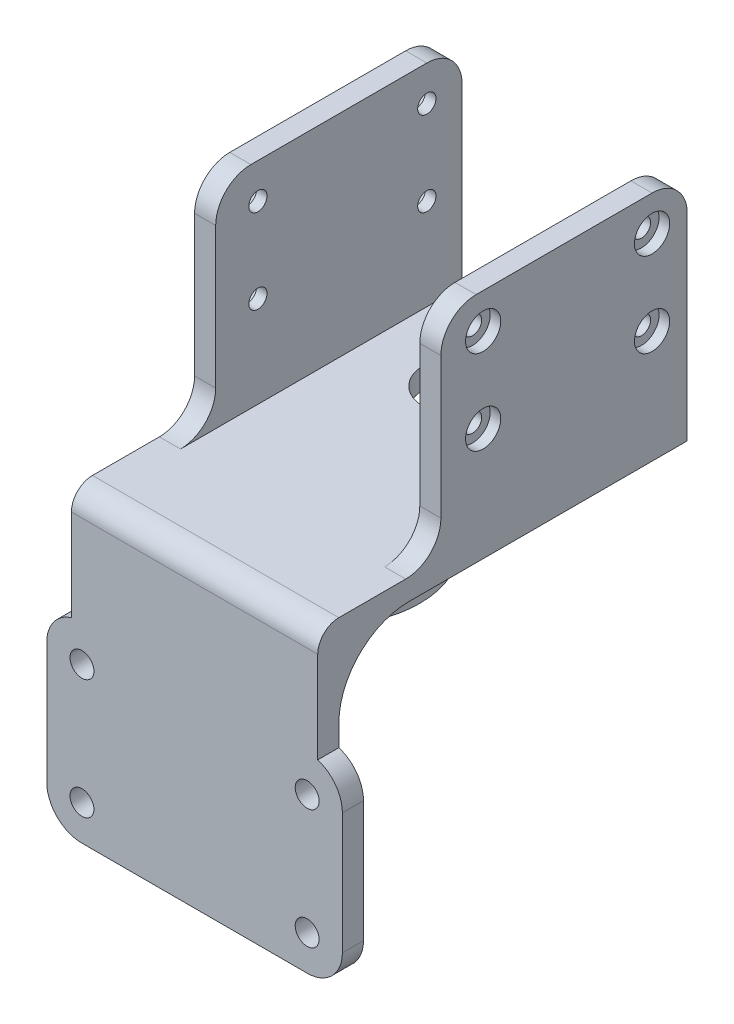
from build123d import *

# Parameters (mm, degrees)
SKETCH1_W             = 3
SKETCH1_H             = 35
BOSS_EXTRUDE1_DEPTH   = 22
BOSS_EXTRUDE1_2_DEPTH = 22
SKETCH2_R             = 1.3
CUT_EXTRUDE1_DEPTH    = 45.891535951
SKETCH4_W             = 3
SKETCH4_H             = 35
BOSS_EXTRUDE3_DEPTH   = 8
BOSS_EXTRUDE4_DEPTH   = 3
SKETCH7_R             = 13.5
BOSS_EXTRUDE5_DEPTH   = 5
SKETCH8_R             = 11.75
CUT_EXTRUDE2_DEPTH    = 3
SKETCH9_R             = 2.5
CUT_EXTRUDE3_DEPTH    = 1.5
CUT_EXTRUDE4_START    = -1.5
SKETCH10_R            = 2.5
CUT_EXTRUDE4_DEPTH    = 1.5
SKETCH11_W            = 35
SKETCH11_H            = 3
BOSS_EXTRUDE6_DEPTH   = 17.5
SKETCH13_W            = 35
SKETCH13_H            = 3
BOSS_EXTRUDE7_DEPTH   = 40
SKETCH14_W            = 42
SKETCH14_H            = 27
BOSS_EXTRUDE8_DEPTH   = 3
SKETCH15_R            = 1.7
CUT_EXTRUDE5_DEPTH    = 40
FILLET1_R             = 10
FILLET2_R             = 5
FILLET3_R             = 3


with BuildPart() as part:
    # Sketch1 → Boss-Extrude1 (new body)
    with BuildSketch(Plane(origin=(0, 0, 0), x_dir=(1, 0, 0), z_dir=(0, 1, 0))):
        with Locations((-16, 0)):
            Rectangle(SKETCH1_W, SKETCH1_H)
    extrude(amount=BOSS_EXTRUDE1_DEPTH)


with BuildPart() as body_2:
    # Sketch1 → Boss-Extrude1 2 (new body)
    with BuildSketch(Plane(origin=(0, 0, 0), x_dir=(1, 0, 0), z_dir=(0, 1, 0))):
        with Locations((16, 0)):
            Rectangle(SKETCH1_W, SKETCH1_H)
    extrude(amount=BOSS_EXTRUDE1_2_DEPTH)


with BuildPart() as cut_extrude1_tool:
    # Sketch2 → Cut-Extrude1 (new, through all)
    with BuildSketch(Plane.ZY.offset(17.5)):
        with Locations((-12.5, 17)):
            Circle(SKETCH2_R)
        with Locations((11.5, 17)):
            Circle(SKETCH2_R)
        with Locations((11.5, 5)):
            Circle(SKETCH2_R)
        with Locations((-12.5, 5)):
            Circle(SKETCH2_R)
    extrude(amount=-CUT_EXTRUDE1_DEPTH)


with BuildPart() as part_1:
    add(part.part)

    # Cut-Extrude1: cut by cut_extrude1_tool
    add(cut_extrude1_tool.part, mode=Mode.SUBTRACT)



with BuildPart() as body_2_1:
    add(body_2.part)

    # Cut-Extrude1: cut by cut_extrude1_tool
    add(cut_extrude1_tool.part, mode=Mode.SUBTRACT)


with BuildPart() as part_2:
    add(part_1.part)

    add(body_2_1.part)  # Boss-Extrude3 merges body 2
    # Sketch4 → Boss-Extrude3 (add)
    with BuildSketch(Plane.XZ):
        with Locations((-16, 0)):
            Rectangle(SKETCH4_W, SKETCH4_H)
        with Locations((16, 0)):
            Rectangle(SKETCH4_W, SKETCH4_H)
    extrude(amount=BOSS_EXTRUDE3_DEPTH)

    # Sketch5 → Boss-Extrude4 (add)
    with BuildSketch(Plane.XZ.offset(8)):
        Polygon((-17.5, 17.5), (17.5, 17.5), (17.5, -17.5), (7.5, -17.5), (7.5, 0), (-7.5, 0), (-7.5, -17.5), (-17.5, -17.5), align=None)
    extrude(amount=BOSS_EXTRUDE4_DEPTH)

    # Sketch7 → Boss-Extrude5 (add)
    with BuildSketch(Plane.XZ.offset(11)):
        with Locations(Location((0, 16.5, 0), (0, 0, 175.751977333))):
            Circle(SKETCH7_R)
    extrude(amount=BOSS_EXTRUDE5_DEPTH)

    # Sketch8 → Cut-Extrude2 (cut)
    with BuildSketch(Plane(origin=(0, -16, 0), x_dir=(-1, 0, 0), z_dir=(0, -1, 0))):
        with Locations(Location((0, -16.5, 0), (0, 0, 90))):
            Circle(SKETCH8_R)
    extrude(amount=-CUT_EXTRUDE2_DEPTH, mode=Mode.SUBTRACT)

    # Sketch9 → Cut-Extrude3 (cut)
    with BuildSketch(Plane.ZY.offset(17.5)):
        with Locations((-12.5, 17)):
            Circle(SKETCH9_R)
        with Locations((11.5, 17)):
            Circle(SKETCH9_R)
        with Locations((11.5, 5)):
            Circle(SKETCH9_R)
        with Locations((-12.5, 5)):
            Circle(SKETCH9_R)
    extrude(amount=-CUT_EXTRUDE3_DEPTH, mode=Mode.SUBTRACT)

    # Sketch10 → Cut-Extrude4 (cut)
    with BuildSketch(Plane(origin=(17.5, 0, 0), x_dir=(0, 0, -1), z_dir=(1, 0, 0)).offset(CUT_EXTRUDE4_START)):
        with Locations(Location((-11.5, 17, 0), (0, 0, 180))):
            Circle(SKETCH10_R)
        with Locations(Location((12.5, 17, 0), (0, 0, 180))):
            Circle(SKETCH10_R)
        with Locations(Location((12.5, 5, 0), (0, 0, 180))):
            Circle(SKETCH10_R)
        with Locations(Location((-11.5, 5, 0), (0, 0, 180))):
            Circle(SKETCH10_R)
    extrude(amount=CUT_EXTRUDE4_DEPTH, mode=Mode.SUBTRACT)

    # Sketch11 → Boss-Extrude6 (add)
    with BuildSketch(Plane.XY.offset(17.5)):
        with Locations((0, -9.5)):
            Rectangle(SKETCH11_W, SKETCH11_H)
    extrude(amount=BOSS_EXTRUDE6_DEPTH)

    # Sketch13 → Boss-Extrude7 (add)
    with BuildSketch(Plane.XZ.offset(11)):
        with Locations((0, 33.5)):
            Rectangle(SKETCH13_W, SKETCH13_H)
    extrude(amount=BOSS_EXTRUDE7_DEPTH)

    # Sketch14 → Boss-Extrude8 (add)
    with BuildSketch(Plane.XY.offset(35)):
        with Locations((0, -37.5)):
            Rectangle(SKETCH14_W, SKETCH14_H)
    extrude(amount=-BOSS_EXTRUDE8_DEPTH)

    # Sketch15 → Cut-Extrude5 (cut)
    with BuildSketch(Plane.XY.offset(35)):
        with Locations((-16, -29)):
            Circle(SKETCH15_R)
        with Locations((16, -29)):
            Circle(SKETCH15_R)
        with Locations((16, -46)):
            Circle(SKETCH15_R)
        with Locations((-16, -46)):
            Circle(SKETCH15_R)
    extrude(amount=-CUT_EXTRUDE5_DEPTH, mode=Mode.SUBTRACT)

    # Fillet1
    # the kernel refuses this fillet: 10 mm, written as the material it adds along each edge
    with BuildSketch(Plane(origin=(17.5, -11, 32), x_dir=(0, 0, -1), z_dir=(-1, 0, 0))) as fillet1_piece_1_section:
        with BuildLine():
            CenterArc((FILLET1_R, FILLET1_R), FILLET1_R, 180, 90)
            Line((0, FILLET1_R), (0, 0))
            Line((0, 0), (FILLET1_R, 0))
        make_face()
    fillet1_piece_1 = extrude(amount=35, mode=Mode.PRIVATE)
    fillet1_piece_1 = fillet1_piece_1 - Plane(origin=(0, -11, 16.5), x_dir=(0, 0, -1), z_dir=(0, -1, 0)) * Cylinder(11.75, 110, mode=Mode.PRIVATE)
    add(fillet1_piece_1)

    # Fillet2
    # the kernel refuses this fillet: 5 mm, written as the material it adds along each edge
    with BuildSketch(Plane(origin=(14.5, -8, 17.5), x_dir=(0, 0, 1), z_dir=(1, 0, 0)), Plane(origin=(-17.5, -8, 17.5), x_dir=(0, 0, 1), z_dir=(1, 0, 0))) as fillet2_piece_1:
        with BuildLine():
            CenterArc((FILLET2_R, -FILLET2_R), FILLET2_R, 90, 90)
            Line((0, -FILLET2_R), (0, 0))
            Line((0, 0), (FILLET2_R, 0))
        make_face()
    extrude(amount=3)
    with BuildSketch(Plane(origin=(-7.5, -8, 0), x_dir=(0, 0, -1), z_dir=(0, -1, 0)), Plane(origin=(7.5, -8, 0), x_dir=(-1, 0, 0), z_dir=(0, -1, 0))) as fillet2_piece_2:
        with BuildLine():
            CenterArc((FILLET2_R, FILLET2_R), FILLET2_R, 180, 90)
            Line((0, FILLET2_R), (0, 0))
            Line((0, 0), (FILLET2_R, 0))
        make_face()
    extrude(amount=3)
    # the kernel refuses this fillet: 5 mm, written as the material it takes off along each edge
    with BuildSketch(Plane(origin=(-30, 22, 17.5), x_dir=(0, 0, -1), z_dir=(1, 0, 0)), Plane(origin=(21, -51, 47.5), x_dir=(0, 1, 0), z_dir=(0, 0, -1)), Plane(origin=(-21, -51, 47.5), x_dir=(1, 0, 0), z_dir=(0, 0, -1)), Plane(origin=(-7.5, 4.5, -17.5), x_dir=(-1, 0, 0), z_dir=(0, -1, 0)), Plane(origin=(7.5, 4.5, -17.5), x_dir=(0, 0, 1), z_dir=(0, -1, 0)), Plane(origin=(2, 22, -17.5), x_dir=(0, -1, 0), z_dir=(1, 0, 0))) as fillet2_2_piece_1:
        with BuildLine():
            CenterArc((FILLET2_R, -FILLET2_R), FILLET2_R, 90, 90)
            Line((0, -FILLET2_R), (0, 0))
            Line((0, 0), (FILLET2_R, 0))
        make_face()
    extrude(amount=28, mode=Mode.SUBTRACT)
    with BuildSketch(Plane(origin=(30, 22, 17.5), x_dir=(0, 0, -1), z_dir=(-1, 0, 0)), Plane(origin=(-2, 22, -17.5), x_dir=(0, -1, 0), z_dir=(-1, 0, 0))) as fillet2_2_piece_2:
        with BuildLine():
            CenterArc((FILLET2_R, FILLET2_R), FILLET2_R, 180, 90)
            Line((0, FILLET2_R), (0, 0))
            Line((0, 0), (FILLET2_R, 0))
        make_face()
    extrude(amount=28, mode=Mode.SUBTRACT)
    with BuildSketch(Plane(origin=(-21, -24, 46.924240018), x_dir=(0, -1, 0), z_dir=(0, 0, -1))) as fillet2_2_piece_3:
        with BuildLine():
            CenterArc((4.769696007, -5), FILLET2_R, 90, 72.542396876)
            Line((0, -3.5), (0, 0))
            Line((0, 0), (4.769696007, 0))
        make_face()
    extrude(amount=26.848480035, mode=Mode.SUBTRACT)
    with BuildSketch(Plane(origin=(21, -24, 46.924240018), x_dir=(-1, 0, 0), z_dir=(0, 0, -1))) as fillet2_2_piece_4:
        with BuildLine():
            CenterArc((5, -4.769696007), FILLET2_R, 107.457603124, 72.542396876)
            Line((0, -4.769696007), (0, 0))
            Line((0, 0), (3.5, 0))
        make_face()
    extrude(amount=26.848480035, mode=Mode.SUBTRACT)

    # Fillet3
    fillet3_edges = [part_2.edges().sort_by_distance(p)[0] for p in [
        (0, -8, 35),
    ]]
    fillet(fillet3_edges, radius=FILLET3_R)


solid = part_2.part
